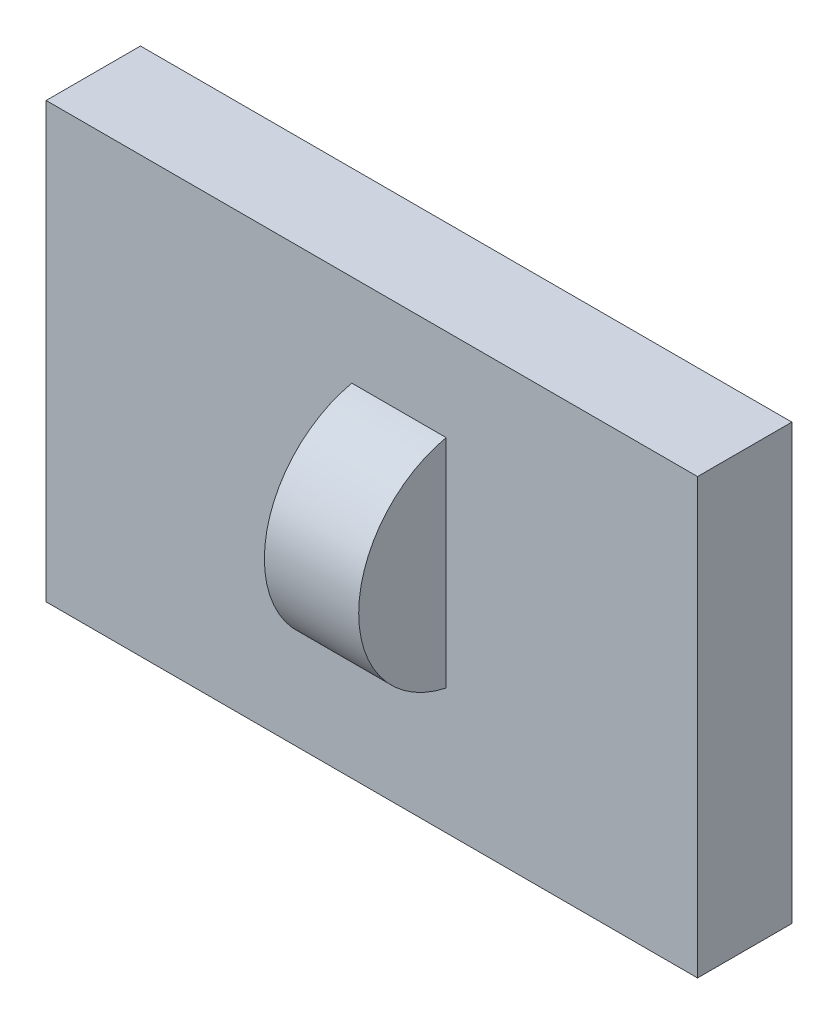
from build123d import *

# Parameters (mm, degrees)
SKETCH_1_W      = 69.064774026
SKETCH_1_H      = 46.043182684
EXTRUDE_1_DEPTH = 10
SKETCH_2_R      = 11.767350743
EXTRUDE_3_DEPTH = 10
OTHER_1_DEPTH   = 10


# Read off the part's stored shape, not the designer's step: Пересечение1
with BuildPart() as part:
    # Эскиз1 → Бобышка-Вытянуть1 (new body)
    with BuildSketch(Plane.XY):
        with Locations((2.12506997, -1.770891642)):
            Rectangle(SKETCH_1_W, SKETCH_1_H)
    extrude(amount=-EXTRUDE_1_DEPTH)


with BuildPart() as body_2:
    # Эскиз2 → Бобышка-Вытянуть3 (new body)
    with BuildSketch(Plane(origin=(0, 0, 0), x_dir=(0, 0, -1), z_dir=(1, 0, 0))):
        with Locations((-19.75002894, 0)):
            Circle(SKETCH_2_R)
    extrude(amount=EXTRUDE_3_DEPTH)


with BuildPart() as body_2_1:
    # Move Body 1: moved
    add(body_2.part.moved(Location((0, 0, -22.247799759))))


with BuildPart() as other_1_tool:
    # Пересечение1 outline → Пересечение1 (new body)
    with BuildSketch(Plane.YZ):
        with BuildLine():
            Line((11.499203644, 0), (-11.499203644, 0))
            ThreePointArc((-11.499203644, 0), (0, -14.265121562), (11.499203644, 0))
        make_face()
    extrude(amount=OTHER_1_DEPTH)


with BuildPart() as part_1:
    add(part.part)

    # Пересечение1: cut by other_1_tool
    add(other_1_tool.part, mode=Mode.SUBTRACT)


with BuildPart() as body_2_2:
    add(body_2_1.part)

    # Пересечение1: cut by other_1_tool
    add(other_1_tool.part, mode=Mode.SUBTRACT)


solid = Compound([part_1.part, body_2_2.part])
